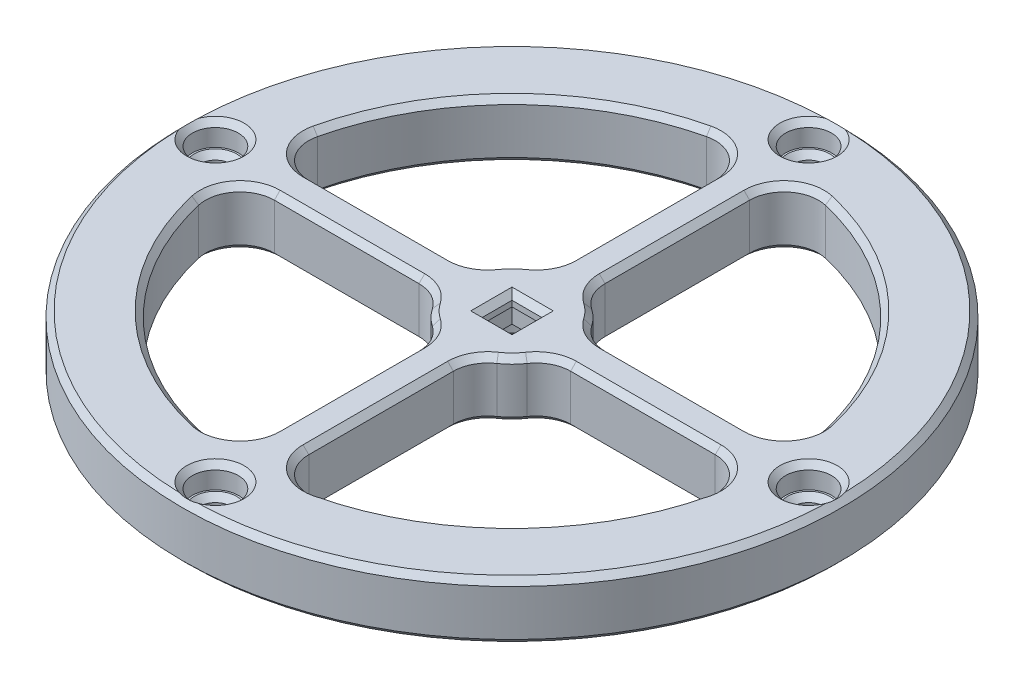
from build123d import *

# Parameters (mm, degrees)
SKETCH1_R           = 36.5125
SKETCH1_R_2         = 1.7145
SKETCH1_W           = 3.302
SKETCH1_H           = 3.302
BOSS_EXTRUDE1_DEPTH = 6.35
FILLET1_R           = 3.81
FILLET2_R           = 3.81
SKETCH2_R           = 2.54
CUT_EXTRUDE4_DEPTH  = 2.54
SKETCH1_4_R         = 5.08
CUT_EXTRUDE2_DEPTH  = 1.27
SKETCH1_5_W         = 6.35
SKETCH1_5_H         = 6.35
CUT_EXTRUDE3_DEPTH  = 5.08
CHAMFER3_SIZE       = 0.635


with BuildPart() as part:
    # Sketch1 → Boss-Extrude1 (new body)
    with BuildSketch(Plane(origin=(0, 0, 0), x_dir=(1, 0, 0), z_dir=(0, 1, 0))):
        with Locations(Location((0, 0, 0), (0, 0, 270))):
            Circle(SKETCH1_R)
        with Locations(Location((-32.86125, 0, 0), (0, 0, 270))):
            Circle(SKETCH1_R_2, mode=Mode.SUBTRACT)
        with BuildLine():
            Line((-1.905, -6.057513929), (-1.905, -28.829629398))
            ThreePointArc((-1.905, -28.829629398), (-20.430082675, -20.430082675), (-28.829629398, -1.905))
            Line((-28.829629398, -1.905), (-6.057513929, -1.905))
            ThreePointArc((-6.057513929, -1.905), (-4.490128061, -4.490128061), (-1.905, -6.057513929))
        make_face(mode=Mode.SUBTRACT)
        with Locations(Location((0, -32.86125, 0), (0, 0, 270))):
            Circle(SKETCH1_R_2, mode=Mode.SUBTRACT)
        with BuildLine():
            Line((1.905, -28.829629398), (1.905, -6.057513929))
            ThreePointArc((1.905, -6.057513929), (4.490128061, -4.490128061), (6.057513929, -1.905))
            Line((6.057513929, -1.905), (28.829629398, -1.905))
            ThreePointArc((28.829629398, -1.905), (20.430082675, -20.430082675), (1.905, -28.829629398))
        make_face(mode=Mode.SUBTRACT)
        with BuildLine():
            Line((-6.057513929, 1.905), (-28.829629398, 1.905))
            ThreePointArc((-28.829629398, 1.905), (-20.430082675, 20.430082675), (-1.905, 28.829629398))
            Line((-1.905, 28.829629398), (-1.905, 6.057513929))
            ThreePointArc((-1.905, 6.057513929), (-4.490128061, 4.490128061), (-6.057513929, 1.905))
        make_face(mode=Mode.SUBTRACT)
        Rectangle(SKETCH1_W, SKETCH1_H, mode=Mode.SUBTRACT)
        with BuildLine():
            Line((28.829629398, 1.905), (6.057513929, 1.905))
            ThreePointArc((6.057513929, 1.905), (4.490128061, 4.490128061), (1.905, 6.057513929))
            Line((1.905, 6.057513929), (1.905, 28.829629398))
            ThreePointArc((1.905, 28.829629398), (20.430082675, 20.430082675), (28.829629398, 1.905))
        make_face(mode=Mode.SUBTRACT)
        with Locations(Location((32.86125, 0, 0), (0, 0, 270))):
            Circle(SKETCH1_R_2, mode=Mode.SUBTRACT)
        with Locations(Location((0, 32.86125, 0), (0, 0, 270))):
            Circle(SKETCH1_R_2, mode=Mode.SUBTRACT)
    extrude(amount=BOSS_EXTRUDE1_DEPTH)

    # Fillet1
    fillet1_edges = [part.edges().sort_by_distance(p)[0] for p in [
        (1.905, 3.175, 6.057513929),
        (6.057513929, 3.175, 1.905),
        (6.057513929, 3.175, -1.905),
        (1.905, 3.175, -6.057513929),
        (-1.905, 3.175, -6.057513929),
        (-6.057513929, 3.175, -1.905),
        (-6.057513929, 3.175, 1.905),
        (-1.905, 3.175, 6.057513929),
    ]]
    fillet(fillet1_edges, radius=FILLET1_R)

    # Fillet2
    fillet2_edges = [part.edges().sort_by_distance(p)[0] for p in [
        (1.905, 3.175, 28.829629398),
        (28.829629398, 3.175, 1.905),
        (28.829629398, 3.175, -1.905),
        (1.905, 3.175, -28.829629398),
        (-1.905, 3.175, -28.829629398),
        (-28.829629398, 3.175, -1.905),
        (-28.829629398, 3.175, 1.905),
        (-1.905, 3.175, 28.829629398),
    ]]
    fillet(fillet2_edges, radius=FILLET2_R)

    # Sketch2 → Cut-Extrude4 (cut)
    with BuildSketch(Plane(origin=(0, 6.35, 0), x_dir=(1, 0, 0), z_dir=(0, 1, 0))):
        with Locations(Location((0, 32.86125, 0), (0, 0, 270))):
            Circle(SKETCH2_R)
        with Locations(Location((32.86125, 0, 0), (0, 0, 270))):
            Circle(SKETCH2_R)
        with Locations(Location((0, -32.86125, 0), (0, 0, 270))):
            Circle(SKETCH2_R)
        with Locations(Location((-32.86125, 0, 0), (0, 0, 270))):
            Circle(SKETCH2_R)
    extrude(amount=-CUT_EXTRUDE4_DEPTH, mode=Mode.SUBTRACT)

    # Sketch1<4> → Cut-Extrude2 (cut)
    with BuildSketch(Plane(origin=(0, 0, 0), x_dir=(1, 0, 0), z_dir=(0, 1, 0))):
        with Locations(Location((0, 0, 0), (0, 0, 270))):
            Circle(SKETCH1_4_R)
    extrude(amount=CUT_EXTRUDE2_DEPTH, mode=Mode.SUBTRACT)

    # Sketch1<5> → Cut-Extrude3 (cut)
    with BuildSketch(Plane(origin=(0, 0, 0), x_dir=(1, 0, 0), z_dir=(0, 1, 0))):
        Rectangle(SKETCH1_5_W, SKETCH1_5_H)
    extrude(amount=CUT_EXTRUDE3_DEPTH, mode=Mode.SUBTRACT)

    # Chamfer3
    # the kernel refuses this chamfer: 0.635 mm, written as the material it takes off along each edge
    with BuildSketch(Plane(origin=(-8.400260413, 0, -1.905), x_dir=(-5.5168229809298586e-15, -0.02749587661058638, 0.9996219169112968), z_dir=(-1, 0, 0)), Plane(origin=(1.905, 0, -8.400260413), x_dir=(-0.9996219169112968, -0.02749587661058638, 2.50498852667661e-15), z_dir=(0, 0, -1)), Plane(origin=(24.422747209, 0, -1.905), x_dir=(0, -0.02749587661058638, 0.9996219169112968), z_dir=(-1, 0, 0)), Plane(origin=(8.400260413, 0, 1.905), x_dir=(0, -0.02749587661058638, -0.9996219169112968), z_dir=(1, 0, 0)), Plane(origin=(1.905, 0, 24.422747209), x_dir=(-0.9996219169112968, -0.02749587661058638, -2.5634707490892933e-15), z_dir=(0, 0, -1)), Plane(origin=(-1.905, 0, 8.400260413), x_dir=(0.9996219169112968, -0.02749587661058638, -3.0605696395971015e-15), z_dir=(0, 0, 1)), Plane(origin=(-24.422747209, 6.35, 1.905), x_dir=(0, -0.9996219169112966, 0.027495876610586282), z_dir=(1, 0, 0)), Plane(origin=(-1.905, 0, -24.422747209), x_dir=(0.9996219169112968, -0.02749587661058638, 2.836387787015148e-15), z_dir=(0, 0, 1))) as chamfer3_piece_1:
        Polygon((CHAMFER3_SIZE * 0.999621916911, CHAMFER3_SIZE * 0.0274958766106), (-CHAMFER3_SIZE * 0.0274958766106, CHAMFER3_SIZE * 0.999621916911), (0, 0), align=None)
    extrude(amount=16.022486797, mode=Mode.SUBTRACT)
    with BuildSketch(Plane(origin=(-8.400260413, 6.35, -1.905), x_dir=(-5.5168229809298586e-15, 0.027495876610585928, 0.9996219169112968), z_dir=(-1, 0, 0)), Plane(origin=(1.905, 6.35, -8.400260413), x_dir=(-0.9996219169112968, 0.027495876610585928, 2.50498852667661e-15), z_dir=(0, 0, -1)), Plane(origin=(24.422747209, 6.35, -1.905), x_dir=(0, 0.027495876610585928, 0.9996219169112968), z_dir=(-1, 0, 0)), Plane(origin=(8.400260413, 6.35, 1.905), x_dir=(0, 0.027495876610585928, -0.9996219169112968), z_dir=(1, 0, 0)), Plane(origin=(1.905, 6.35, 24.422747209), x_dir=(-0.9996219169112968, 0.027495876610585928, -2.5634707490892933e-15), z_dir=(0, 0, -1)), Plane(origin=(-1.905, 6.35, 8.400260413), x_dir=(0.9996219169112968, 0.027495876610585928, -3.0605696395971015e-15), z_dir=(0, 0, 1)), Plane(origin=(-24.422747209, 0, 1.905), x_dir=(0, 0.9996219169112966, 0.02749587661058626), z_dir=(1, 0, 0)), Plane(origin=(-1.905, 6.35, -24.422747209), x_dir=(0.9996219169112968, 0.027495876610585928, 2.836387787015148e-15), z_dir=(0, 0, 1))) as chamfer3_piece_2:
        Polygon((CHAMFER3_SIZE * 0.999621916911, -CHAMFER3_SIZE * 0.0274958766106), (-CHAMFER3_SIZE * 0.0274958766106, -CHAMFER3_SIZE * 0.999621916911), (0, 0), align=None)
    extrude(amount=16.022486797, mode=Mode.SUBTRACT)
    with BuildSketch(Plane(origin=(0, 0, 0), x_dir=(0.8267972847076867, 0, -0.5624999999999969), z_dir=(0.5624999999999969, 0, 0.8267972847076867))) as chamfer3_piece_3:
        Polygon((6.35 - CHAMFER3_SIZE, 0), (6.35, CHAMFER3_SIZE), (6.35, 0), align=None)
    revolve(axis=Axis((0, 0, 0), (0, 1, 0)), revolution_arc=21.542267344, mode=Mode.SUBTRACT)
    with BuildSketch(Plane(origin=(0, 6.35, 0), x_dir=(0.8267972847076867, 0, -0.5624999999999969), z_dir=(0.5624999999999969, 0, 0.8267972847076867))) as chamfer3_piece_4:
        Polygon((6.35 - CHAMFER3_SIZE, 0), (6.35, -CHAMFER3_SIZE), (6.35, 0), align=None)
    revolve(axis=Axis((0, 6.35, 0), (0, 1, 0)), revolution_arc=21.542267344, mode=Mode.SUBTRACT)
    with BuildSketch(Plane(origin=(0, 0, 0), x_dir=(0.5625000000000041, 0, 0.8267972847076818), z_dir=(-0.8267972847076818, 0, 0.5625000000000041))) as chamfer3_piece_5:
        Polygon((6.35 - CHAMFER3_SIZE, 0), (6.35, CHAMFER3_SIZE), (6.35, 0), align=None)
    revolve(axis=Axis((0, 0, 0), (0, 1, 0)), revolution_arc=21.542267344, mode=Mode.SUBTRACT)
    with BuildSketch(Plane(origin=(0, 6.35, 0), x_dir=(0.5625000000000041, 0, 0.8267972847076818), z_dir=(-0.8267972847076818, 0, 0.5625000000000041))) as chamfer3_piece_6:
        Polygon((6.35 - CHAMFER3_SIZE, 0), (6.35, -CHAMFER3_SIZE), (6.35, 0), align=None)
    revolve(axis=Axis((0, 6.35, 0), (0, 1, 0)), revolution_arc=21.542267344, mode=Mode.SUBTRACT)
    with BuildSketch(Plane(origin=(0, 0, 0), x_dir=(-0.8267972847076919, 0, 0.5624999999999892), z_dir=(-0.5624999999999892, 0, -0.8267972847076919))) as chamfer3_piece_7:
        Polygon((6.35 - CHAMFER3_SIZE, 0), (6.35, CHAMFER3_SIZE), (6.35, 0), align=None)
    revolve(axis=Axis((0, 0, 0), (0, 1, 0)), revolution_arc=21.542267344, mode=Mode.SUBTRACT)
    with BuildSketch(Plane(origin=(0, 6.35, 0), x_dir=(-0.8267972847076919, 0, 0.5624999999999892), z_dir=(-0.5624999999999892, 0, -0.8267972847076919))) as chamfer3_piece_8:
        Polygon((6.35 - CHAMFER3_SIZE, 0), (6.35, -CHAMFER3_SIZE), (6.35, 0), align=None)
    revolve(axis=Axis((0, 6.35, 0), (0, 1, 0)), revolution_arc=21.542267344, mode=Mode.SUBTRACT)
    with BuildSketch(Plane(origin=(-5.715, 0, -8.400260413), x_dir=(1, 0, 0), z_dir=(0, 0, -1))) as chamfer3_piece_9:
        Polygon((3.81 + CHAMFER3_SIZE, 0), (3.81, -CHAMFER3_SIZE), (3.81, 0), align=None)
    revolve(axis=Axis((-5.715, 0, -8.400260413), (0, -1, 0)), revolution_arc=55.771133672, mode=Mode.SUBTRACT)
    with BuildSketch(Plane(origin=(-5.715, 6.35, -8.400260413), x_dir=(1, 0, 0), z_dir=(0, 0, -1))) as chamfer3_piece_10:
        Polygon((3.81 + CHAMFER3_SIZE, 0), (3.81, CHAMFER3_SIZE), (3.81, 0), align=None)
    revolve(axis=Axis((-5.715, 6.35, -8.400260413), (0, -1, 0)), revolution_arc=55.771133672, mode=Mode.SUBTRACT)
    with BuildSketch(Plane(origin=(-8.400260413, 0, -5.715), x_dir=(0.826797284707692, 0, 0.562499999999989), z_dir=(0.562499999999989, 0, -0.826797284707692))) as chamfer3_piece_11:
        Polygon((3.81 + CHAMFER3_SIZE, 0), (3.81, -CHAMFER3_SIZE), (3.81, 0), align=None)
    revolve(axis=Axis((-8.400260413, 0, -5.715), (0, -1, 0)), revolution_arc=55.771133672, mode=Mode.SUBTRACT)
    with BuildSketch(Plane(origin=(-8.400260413, 6.35, -5.715), x_dir=(0.826797284707692, 0, 0.562499999999989), z_dir=(0.562499999999989, 0, -0.826797284707692))) as chamfer3_piece_12:
        Polygon((3.81 + CHAMFER3_SIZE, 0), (3.81, CHAMFER3_SIZE), (3.81, 0), align=None)
    revolve(axis=Axis((-8.400260413, 6.35, -5.715), (0, -1, 0)), revolution_arc=55.771133672, mode=Mode.SUBTRACT)
    with BuildSketch(Plane(origin=(5.715, 0, -8.400260413), x_dir=(-0.562500000000004, 0, 0.8267972847076819), z_dir=(0.8267972847076819, 0, 0.562500000000004))) as chamfer3_piece_13:
        Polygon((3.81 + CHAMFER3_SIZE, 0), (3.81, -CHAMFER3_SIZE), (3.81, 0), align=None)
    revolve(axis=Axis((5.715, 0, -8.400260413), (0, -1, 0)), revolution_arc=55.771133672, mode=Mode.SUBTRACT)
    with BuildSketch(Plane(origin=(5.715, 6.35, -8.400260413), x_dir=(-0.562500000000004, 0, 0.8267972847076819), z_dir=(0.8267972847076819, 0, 0.562500000000004))) as chamfer3_piece_14:
        Polygon((3.81 + CHAMFER3_SIZE, 0), (3.81, CHAMFER3_SIZE), (3.81, 0), align=None)
    revolve(axis=Axis((5.715, 6.35, -8.400260413), (0, -1, 0)), revolution_arc=55.771133672, mode=Mode.SUBTRACT)
    with BuildSketch(Plane(origin=(8.400260413, 0, -5.715), x_dir=(0, 0, 1), z_dir=(1, 0, 0))) as chamfer3_piece_15:
        Polygon((3.81 + CHAMFER3_SIZE, 0), (3.81, -CHAMFER3_SIZE), (3.81, 0), align=None)
    revolve(axis=Axis((8.400260413, 0, -5.715), (0, -1, 0)), revolution_arc=55.771133672, mode=Mode.SUBTRACT)
    with BuildSketch(Plane(origin=(8.400260413, 6.35, -5.715), x_dir=(0, 0, 1), z_dir=(1, 0, 0))) as chamfer3_piece_16:
        Polygon((3.81 + CHAMFER3_SIZE, 0), (3.81, CHAMFER3_SIZE), (3.81, 0), align=None)
    revolve(axis=Axis((8.400260413, 6.35, -5.715), (0, -1, 0)), revolution_arc=55.771133672, mode=Mode.SUBTRACT)
    with BuildSketch(Plane(origin=(8.400260413, 0, 5.715), x_dir=(-0.8267972847076864, 0, -0.5624999999999973), z_dir=(-0.5624999999999973, 0, 0.8267972847076864))) as chamfer3_piece_17:
        Polygon((3.81 + CHAMFER3_SIZE, 0), (3.81, -CHAMFER3_SIZE), (3.81, 0), align=None)
    revolve(axis=Axis((8.400260413, 0, 5.715), (0, -1, 0)), revolution_arc=55.771133672, mode=Mode.SUBTRACT)
    with BuildSketch(Plane(origin=(8.400260413, 6.35, 5.715), x_dir=(-0.8267972847076864, 0, -0.5624999999999973), z_dir=(-0.5624999999999973, 0, 0.8267972847076864))) as chamfer3_piece_18:
        Polygon((3.81 + CHAMFER3_SIZE, 0), (3.81, CHAMFER3_SIZE), (3.81, 0), align=None)
    revolve(axis=Axis((8.400260413, 6.35, 5.715), (0, -1, 0)), revolution_arc=55.771133672, mode=Mode.SUBTRACT)
    with BuildSketch(Plane(origin=(5.715, 0, 8.400260413), x_dir=(-1, 0, 0), z_dir=(0, 0, 1))) as chamfer3_piece_19:
        Polygon((3.81 + CHAMFER3_SIZE, 0), (3.81, -CHAMFER3_SIZE), (3.81, 0), align=None)
    revolve(axis=Axis((5.715, 0, 8.400260413), (0, -1, 0)), revolution_arc=55.771133672, mode=Mode.SUBTRACT)
    with BuildSketch(Plane(origin=(5.715, 6.35, 8.400260413), x_dir=(-1, 0, 0), z_dir=(0, 0, 1))) as chamfer3_piece_20:
        Polygon((3.81 + CHAMFER3_SIZE, 0), (3.81, CHAMFER3_SIZE), (3.81, 0), align=None)
    revolve(axis=Axis((5.715, 6.35, 8.400260413), (0, -1, 0)), revolution_arc=55.771133672, mode=Mode.SUBTRACT)
    with BuildSketch(Plane(origin=(-5.715, 0, 8.400260413), x_dir=(0.5625000000000068, 0, -0.82679728470768), z_dir=(-0.82679728470768, 0, -0.5625000000000068))) as chamfer3_piece_21:
        Polygon((3.81 + CHAMFER3_SIZE, 0), (3.81, -CHAMFER3_SIZE), (3.81, 0), align=None)
    revolve(axis=Axis((-5.715, 0, 8.400260413), (0, -1, 0)), revolution_arc=55.771133672, mode=Mode.SUBTRACT)
    with BuildSketch(Plane(origin=(-5.715, 6.35, 8.400260413), x_dir=(0.5625000000000068, 0, -0.82679728470768), z_dir=(-0.82679728470768, 0, -0.5625000000000068))) as chamfer3_piece_22:
        Polygon((3.81 + CHAMFER3_SIZE, 0), (3.81, CHAMFER3_SIZE), (3.81, 0), align=None)
    revolve(axis=Axis((-5.715, 6.35, 8.400260413), (0, -1, 0)), revolution_arc=55.771133672, mode=Mode.SUBTRACT)
    with BuildSketch(Plane(origin=(-8.400260413, 0, 5.715), x_dir=(0, 0, -1), z_dir=(-1, 0, 0))) as chamfer3_piece_23:
        Polygon((3.81 + CHAMFER3_SIZE, 0), (3.81, -CHAMFER3_SIZE), (3.81, 0), align=None)
    revolve(axis=Axis((-8.400260413, 0, 5.715), (0, -1, 0)), revolution_arc=55.771133672, mode=Mode.SUBTRACT)
    with BuildSketch(Plane(origin=(-8.400260413, 6.35, 5.715), x_dir=(0, 0, -1), z_dir=(-1, 0, 0))) as chamfer3_piece_24:
        Polygon((3.81, CHAMFER3_SIZE), (3.81 + CHAMFER3_SIZE, 0), (3.81, 0), align=None)
    revolve(axis=Axis((-8.400260413, 6.35, 5.715), (0, -1, 0)), revolution_arc=55.771133672, mode=Mode.SUBTRACT)
    with BuildSketch(Plane(origin=(0, 0, 0), x_dir=(0.22784810126582303, 0, -0.9736966892978323), z_dir=(-0.9736966892978323, 0, -0.22784810126582303))) as chamfer3_piece_25:
        Polygon((28.8925 + CHAMFER3_SIZE, 0), (28.8925, -CHAMFER3_SIZE), (28.8925, 0), align=None)
    revolve(axis=Axis((0, 0, 0), (0, -1, 0)), revolution_arc=63.659172995, mode=Mode.SUBTRACT)
    with BuildSketch(Plane(origin=(0, 6.35, 0), x_dir=(0.22784810126582303, 0, -0.9736966892978323), z_dir=(-0.9736966892978323, 0, -0.22784810126582303))) as chamfer3_piece_26:
        Polygon((28.8925 + CHAMFER3_SIZE, 0), (28.8925, CHAMFER3_SIZE), (28.8925, 0), align=None)
    revolve(axis=Axis((0, 6.35, 0), (0, -1, 0)), revolution_arc=63.659172995, mode=Mode.SUBTRACT)
    with BuildSketch(Plane(origin=(0, 0, 0), x_dir=(0.9736966892978326, 0, 0.22784810126582175), z_dir=(0.22784810126582175, 0, -0.9736966892978326))) as chamfer3_piece_27:
        Polygon((28.8925 + CHAMFER3_SIZE, 0), (28.8925, -CHAMFER3_SIZE), (28.8925, 0), align=None)
    revolve(axis=Axis((0, 0, 0), (0, -1, 0)), revolution_arc=63.659172995, mode=Mode.SUBTRACT)
    with BuildSketch(Plane(origin=(0, 6.35, 0), x_dir=(0.9736966892978326, 0, 0.22784810126582175), z_dir=(0.22784810126582175, 0, -0.9736966892978326))) as chamfer3_piece_28:
        Polygon((28.8925 + CHAMFER3_SIZE, 0), (28.8925, CHAMFER3_SIZE), (28.8925, 0), align=None)
    revolve(axis=Axis((0, 6.35, 0), (0, -1, 0)), revolution_arc=63.659172995, mode=Mode.SUBTRACT)
    with BuildSketch(Plane(origin=(0, 0, 0), x_dir=(-0.22784810126582355, 0, 0.9736966892978322), z_dir=(0.9736966892978322, 0, 0.22784810126582355))) as chamfer3_piece_29:
        Polygon((28.8925 + CHAMFER3_SIZE, 0), (28.8925, -CHAMFER3_SIZE), (28.8925, 0), align=None)
    revolve(axis=Axis((0, 0, 0), (0, -1, 0)), revolution_arc=63.659172995, mode=Mode.SUBTRACT)
    with BuildSketch(Plane(origin=(0, 6.35, 0), x_dir=(-0.22784810126582355, 0, 0.9736966892978322), z_dir=(0.9736966892978322, 0, 0.22784810126582355))) as chamfer3_piece_30:
        Polygon((28.8925 + CHAMFER3_SIZE, 0), (28.8925, CHAMFER3_SIZE), (28.8925, 0), align=None)
    revolve(axis=Axis((0, 6.35, 0), (0, -1, 0)), revolution_arc=63.659172995, mode=Mode.SUBTRACT)
    with BuildSketch(Plane(origin=(0, 0, 0), x_dir=(-0.9736966892978325, 0, -0.22784810126582164), z_dir=(-0.22784810126582164, 0, 0.9736966892978325))) as chamfer3_piece_31:
        Polygon((28.8925 + CHAMFER3_SIZE, 0), (28.8925, -CHAMFER3_SIZE), (28.8925, 0), align=None)
    revolve(axis=Axis((0, 0, 0), (0, -1, 0)), revolution_arc=63.659172995, mode=Mode.SUBTRACT)
    with BuildSketch(Plane(origin=(0, 6.35, 0), x_dir=(-0.9736966892978325, 0, -0.22784810126582164), z_dir=(-0.22784810126582164, 0, 0.9736966892978325))) as chamfer3_piece_32:
        Polygon((28.8925 + CHAMFER3_SIZE, 0), (28.8925, CHAMFER3_SIZE), (28.8925, 0), align=None)
    revolve(axis=Axis((0, 6.35, 0), (0, -1, 0)), revolution_arc=63.659172995, mode=Mode.SUBTRACT)
    with BuildSketch(Plane(origin=(24.422747209, 0, -5.715), x_dir=(0, 0, 1), z_dir=(-1, 0, 0))) as chamfer3_piece_33:
        Polygon((3.81 + CHAMFER3_SIZE, 0), (3.81, CHAMFER3_SIZE), (3.81, 0), align=None)
    revolve(axis=Axis((24.422747209, 0, -5.715), (0, 1, 0)), revolution_arc=103.170413502, mode=Mode.SUBTRACT)
    with BuildSketch(Plane(origin=(24.422747209, 6.35, -5.715), x_dir=(0, 0, 1), z_dir=(-1, 0, 0))) as chamfer3_piece_34:
        Polygon((3.81 + CHAMFER3_SIZE, 0), (3.81, -CHAMFER3_SIZE), (3.81, 0), align=None)
    revolve(axis=Axis((24.422747209, 6.35, -5.715), (0, 1, 0)), revolution_arc=103.170413502, mode=Mode.SUBTRACT)
    with BuildSketch(Plane(origin=(24.422747209, 0, 5.715), x_dir=(0.9736966892978325, 0, 0.22784810126582164), z_dir=(-0.22784810126582164, 0, 0.9736966892978325))) as chamfer3_piece_35:
        Polygon((3.81 + CHAMFER3_SIZE, 0), (3.81, CHAMFER3_SIZE), (3.81, 0), align=None)
    revolve(axis=Axis((24.422747209, 0, 5.715), (0, 1, 0)), revolution_arc=103.170413502, mode=Mode.SUBTRACT)
    with BuildSketch(Plane(origin=(24.422747209, 6.35, 5.715), x_dir=(0.9736966892978325, 0, 0.22784810126582164), z_dir=(-0.22784810126582164, 0, 0.9736966892978325))) as chamfer3_piece_36:
        Polygon((3.81 + CHAMFER3_SIZE, 0), (3.81, -CHAMFER3_SIZE), (3.81, 0), align=None)
    revolve(axis=Axis((24.422747209, 6.35, 5.715), (0, 1, 0)), revolution_arc=103.170413502, mode=Mode.SUBTRACT)
    with BuildSketch(Plane(origin=(5.715, 0, 24.422747209), x_dir=(-1, 0, 0), z_dir=(0, 0, -1))) as chamfer3_piece_37:
        Polygon((3.81 + CHAMFER3_SIZE, 0), (3.81, CHAMFER3_SIZE), (3.81, 0), align=None)
    revolve(axis=Axis((5.715, 0, 24.422747209), (0, 1, 0)), revolution_arc=103.170413502, mode=Mode.SUBTRACT)
    with BuildSketch(Plane(origin=(5.715, 6.35, 24.422747209), x_dir=(-1, 0, 0), z_dir=(0, 0, -1))) as chamfer3_piece_38:
        Polygon((3.81 + CHAMFER3_SIZE, 0), (3.81, -CHAMFER3_SIZE), (3.81, 0), align=None)
    revolve(axis=Axis((5.715, 6.35, 24.422747209), (0, 1, 0)), revolution_arc=103.170413502, mode=Mode.SUBTRACT)
    with BuildSketch(Plane(origin=(-5.715, 0, 24.422747209), x_dir=(-0.22784810126582408, 0, 0.973696689297832), z_dir=(-0.973696689297832, 0, -0.22784810126582408))) as chamfer3_piece_39:
        Polygon((3.81 + CHAMFER3_SIZE, 0), (3.81, CHAMFER3_SIZE), (3.81, 0), align=None)
    revolve(axis=Axis((-5.715, 0, 24.422747209), (0, 1, 0)), revolution_arc=103.170413502, mode=Mode.SUBTRACT)
    with BuildSketch(Plane(origin=(-5.715, 6.35, 24.422747209), x_dir=(-0.22784810126582408, 0, 0.973696689297832), z_dir=(-0.973696689297832, 0, -0.22784810126582408))) as chamfer3_piece_40:
        Polygon((3.81 + CHAMFER3_SIZE, 0), (3.81, -CHAMFER3_SIZE), (3.81, 0), align=None)
    revolve(axis=Axis((-5.715, 6.35, 24.422747209), (0, 1, 0)), revolution_arc=103.170413502, mode=Mode.SUBTRACT)
    with BuildSketch(Plane(origin=(-24.422747209, 0, -5.715), x_dir=(-0.9736966892978324, 0, -0.2278481012658223), z_dir=(0.2278481012658223, 0, -0.9736966892978324))) as chamfer3_piece_41:
        Polygon((3.81 + CHAMFER3_SIZE, 0), (3.81, CHAMFER3_SIZE), (3.81, 0), align=None)
    revolve(axis=Axis((-24.422747209, 0, -5.715), (0, 1, 0)), revolution_arc=103.170413502, mode=Mode.SUBTRACT)
    with BuildSketch(Plane(origin=(-24.422747209, 6.35, -5.715), x_dir=(-0.9736966892978324, 0, -0.2278481012658223), z_dir=(0.2278481012658223, 0, -0.9736966892978324))) as chamfer3_piece_42:
        Polygon((3.81 + CHAMFER3_SIZE, 0), (3.81, -CHAMFER3_SIZE), (3.81, 0), align=None)
    revolve(axis=Axis((-24.422747209, 6.35, -5.715), (0, 1, 0)), revolution_arc=103.170413502, mode=Mode.SUBTRACT)
    with BuildSketch(Plane(origin=(-24.422747209, 0, 5.715), x_dir=(0, 0, -1), z_dir=(1, 0, 0))) as chamfer3_piece_43:
        Polygon((3.81 + CHAMFER3_SIZE, 0), (3.81, CHAMFER3_SIZE), (3.81, 0), align=None)
    revolve(axis=Axis((-24.422747209, 0, 5.715), (0, 1, 0)), revolution_arc=103.170413502, mode=Mode.SUBTRACT)
    with BuildSketch(Plane(origin=(-24.422747209, 6.35, 5.715), x_dir=(0, 0, -1), z_dir=(1, 0, 0))) as chamfer3_piece_44:
        Polygon((3.81, -CHAMFER3_SIZE), (3.81 + CHAMFER3_SIZE, 0), (3.81, 0), align=None)
    revolve(axis=Axis((-24.422747209, 6.35, 5.715), (0, 1, 0)), revolution_arc=103.170413502, mode=Mode.SUBTRACT)
    with BuildSketch(Plane(origin=(5.715, 0, -24.422747209), x_dir=(0.2278481012658232, 0, -0.9736966892978322), z_dir=(0.9736966892978322, 0, 0.2278481012658232))) as chamfer3_piece_45:
        Polygon((3.81 + CHAMFER3_SIZE, 0), (3.81, CHAMFER3_SIZE), (3.81, 0), align=None)
    revolve(axis=Axis((5.715, 0, -24.422747209), (0, 1, 0)), revolution_arc=103.170413502, mode=Mode.SUBTRACT)
    with BuildSketch(Plane(origin=(5.715, 6.35, -24.422747209), x_dir=(0.2278481012658232, 0, -0.9736966892978322), z_dir=(0.9736966892978322, 0, 0.2278481012658232))) as chamfer3_piece_46:
        Polygon((3.81 + CHAMFER3_SIZE, 0), (3.81, -CHAMFER3_SIZE), (3.81, 0), align=None)
    revolve(axis=Axis((5.715, 6.35, -24.422747209), (0, 1, 0)), revolution_arc=103.170413502, mode=Mode.SUBTRACT)
    with BuildSketch(Plane(origin=(-5.715, 0, -24.422747209), x_dir=(1, 0, 0), z_dir=(0, 0, 1))) as chamfer3_piece_47:
        Polygon((3.81 + CHAMFER3_SIZE, 0), (3.81, CHAMFER3_SIZE), (3.81, 0), align=None)
    revolve(axis=Axis((-5.715, 0, -24.422747209), (0, 1, 0)), revolution_arc=103.170413502, mode=Mode.SUBTRACT)
    with BuildSketch(Plane(origin=(-5.715, 6.35, -24.422747209), x_dir=(1, 0, 0), z_dir=(0, 0, 1))) as chamfer3_piece_48:
        Polygon((3.81 + CHAMFER3_SIZE, 0), (3.81, -CHAMFER3_SIZE), (3.81, 0), align=None)
    revolve(axis=Axis((-5.715, 6.35, -24.422747209), (0, 1, 0)), revolution_arc=103.170413502, mode=Mode.SUBTRACT)
    with BuildSketch(Plane(origin=(-32.86125, 0, 0), x_dir=(0, 0, 1), z_dir=(-1, 0, 0))) as chamfer3_piece_49:
        Polygon((1.7145 + CHAMFER3_SIZE, 0), (1.7145, CHAMFER3_SIZE), (1.7145, 0), align=None)
    revolve(axis=Axis((-32.86125, 0, 0), (0, 1, 0)), mode=Mode.SUBTRACT)
    with BuildSketch(Plane(origin=(0, 0, -32.86125), x_dir=(0, 0, 1), z_dir=(-1, 0, 0))) as chamfer3_piece_50:
        Polygon((1.7145 + CHAMFER3_SIZE, 0), (1.7145, CHAMFER3_SIZE), (1.7145, 0), align=None)
    revolve(axis=Axis((0, 0, -32.86125), (0, 1, 0)), mode=Mode.SUBTRACT)
    with BuildSketch(Plane(origin=(32.86125, 0, 0), x_dir=(0, 0, 1), z_dir=(-1, 0, 0))) as chamfer3_piece_51:
        Polygon((1.7145 + CHAMFER3_SIZE, 0), (1.7145, CHAMFER3_SIZE), (1.7145, 0), align=None)
    revolve(axis=Axis((32.86125, 0, 0), (0, 1, 0)), mode=Mode.SUBTRACT)
    with BuildSketch(Plane(origin=(0, 0, 32.86125), x_dir=(0, 0, 1), z_dir=(-1, 0, 0))) as chamfer3_piece_52:
        Polygon((1.7145 + CHAMFER3_SIZE, 0), (1.7145, CHAMFER3_SIZE), (1.7145, 0), align=None)
    revolve(axis=Axis((0, 0, 32.86125), (0, 1, 0)), mode=Mode.SUBTRACT)
    with BuildSketch(Plane(origin=(0, 0, 0), x_dir=(0, 0, 1), z_dir=(-1, 0, 0))) as chamfer3_piece_53:
        Polygon((36.5125 - CHAMFER3_SIZE, 0), (36.5125, CHAMFER3_SIZE), (36.5125, 0), align=None)
    revolve(axis=Axis((0, 0, 0), (0, 1, 0)), mode=Mode.SUBTRACT)
    with BuildSketch(Plane(origin=(-32.86125, 3.81, 0), x_dir=(0, 0, 1), z_dir=(1, 0, 0))) as chamfer3_piece_54:
        Polygon((1.7145, CHAMFER3_SIZE), (1.7145 + CHAMFER3_SIZE, 0), (1.7145, 0), align=None)
    revolve(axis=Axis((-32.86125, 3.81, 0), (0, -1, 0)), mode=Mode.SUBTRACT)
    with BuildSketch(Plane(origin=(-32.86125, 6.35, 0), x_dir=(0, 0, 1), z_dir=(-1, 0, 0))) as chamfer3_piece_55:
        Polygon((2.54 + CHAMFER3_SIZE, 0), (2.54, -CHAMFER3_SIZE), (2.54, 0), align=None)
    revolve(axis=Axis((-32.86125, 6.35, 0), (0, 1, 0)), mode=Mode.SUBTRACT)
    with BuildSketch(Plane(origin=(0, 3.81, 32.86125), x_dir=(0, 0, 1), z_dir=(1, 0, 0))) as chamfer3_piece_56:
        Polygon((1.7145, CHAMFER3_SIZE), (1.7145 + CHAMFER3_SIZE, 0), (1.7145, 0), align=None)
    revolve(axis=Axis((0, 3.81, 32.86125), (0, -1, 0)), mode=Mode.SUBTRACT)
    with BuildSketch(Plane(origin=(0, 6.35, 32.86125), x_dir=(0, 0, 1), z_dir=(-1, 0, 0))) as chamfer3_piece_57:
        Polygon((2.54 + CHAMFER3_SIZE, 0), (2.54, -CHAMFER3_SIZE), (2.54, 0), align=None)
    revolve(axis=Axis((0, 6.35, 32.86125), (0, 1, 0)), mode=Mode.SUBTRACT)
    with BuildSketch(Plane(origin=(32.86125, 3.81, 0), x_dir=(0, 0, 1), z_dir=(1, 0, 0))) as chamfer3_piece_58:
        Polygon((1.7145, CHAMFER3_SIZE), (1.7145 + CHAMFER3_SIZE, 0), (1.7145, 0), align=None)
    revolve(axis=Axis((32.86125, 3.81, 0), (0, -1, 0)), mode=Mode.SUBTRACT)
    with BuildSketch(Plane(origin=(32.86125, 6.35, 0), x_dir=(0, 0, 1), z_dir=(-1, 0, 0))) as chamfer3_piece_59:
        Polygon((2.54 + CHAMFER3_SIZE, 0), (2.54, -CHAMFER3_SIZE), (2.54, 0), align=None)
    revolve(axis=Axis((32.86125, 6.35, 0), (0, 1, 0)), mode=Mode.SUBTRACT)
    with BuildSketch(Plane(origin=(0, 3.81, -32.86125), x_dir=(0, 0, 1), z_dir=(1, 0, 0))) as chamfer3_piece_60:
        Polygon((1.7145, CHAMFER3_SIZE), (1.7145 + CHAMFER3_SIZE, 0), (1.7145, 0), align=None)
    revolve(axis=Axis((0, 3.81, -32.86125), (0, -1, 0)), mode=Mode.SUBTRACT)
    with BuildSketch(Plane(origin=(0, 6.35, -32.86125), x_dir=(0, 0, 1), z_dir=(-1, 0, 0))) as chamfer3_piece_61:
        Polygon((2.54 + CHAMFER3_SIZE, 0), (2.54, -CHAMFER3_SIZE), (2.54, 0), align=None)
    revolve(axis=Axis((0, 6.35, -32.86125), (0, 1, 0)), mode=Mode.SUBTRACT)
    with BuildSketch(Plane(origin=(0, 0, 0), x_dir=(0, 0, 1), z_dir=(-1, 0, 0))) as chamfer3_piece_62:
        Polygon((5.08 + CHAMFER3_SIZE, 0), (5.08, CHAMFER3_SIZE), (5.08, 0), align=None)
    revolve(axis=Axis((0, 0, 0), (0, 1, 0)), mode=Mode.SUBTRACT)
    with BuildSketch(Plane(origin=(-3.175, 1.27, 3.175), x_dir=(-0.9996219169112968, -0.027495876610586268, 0), z_dir=(0, 0, -1)), Plane(origin=(-3.175, 1.27, -3.175), x_dir=(0, -0.027495876610586268, -0.9996219169112968), z_dir=(1, 0, 0)), Plane(origin=(3.175, 1.27, -3.175), x_dir=(0.9996219169112968, -0.027495876610586268, 0), z_dir=(0, 0, 1)), Plane(origin=(3.175, 1.27, 3.175), x_dir=(0, -0.027495876610586268, 0.9996219169112968), z_dir=(-1, 0, 0))) as chamfer3_piece_63:
        Polygon((CHAMFER3_SIZE * 0.999621916911, CHAMFER3_SIZE * 0.0274958766106), (-CHAMFER3_SIZE * 0.0274958766106, CHAMFER3_SIZE * 0.999621916911), (0, 0), align=None)
    extrude(amount=6.35, mode=Mode.SUBTRACT)
    with BuildSketch(Plane(origin=(-1.651, 6.35, 1.651), x_dir=(-0.9996219169112968, 0.027495876610585928, 0), z_dir=(0, 0, -1)), Plane(origin=(-1.651, 6.35, -1.651), x_dir=(0, 0.02749587661058592, -0.9996219169112968), z_dir=(1, 0, 0)), Plane(origin=(1.651, 6.35, -1.651), x_dir=(0.9996219169112968, 0.02749587661058592, 0), z_dir=(0, 0, 1)), Plane(origin=(1.651, 6.35, 1.651), x_dir=(0, 0.027495876610585928, 0.9996219169112968), z_dir=(-1, 0, 0))) as chamfer3_piece_64:
        Polygon((CHAMFER3_SIZE * 0.999621916911, -CHAMFER3_SIZE * 0.0274958766106), (-CHAMFER3_SIZE * 0.0274958766106, -CHAMFER3_SIZE * 0.999621916911), (0, 0), align=None)
    extrude(amount=3.302, mode=Mode.SUBTRACT)
    with BuildSketch(Plane(origin=(0, 6.35, 0), x_dir=(0, 0, 1), z_dir=(-1, 0, 0))) as chamfer3_piece_65:
        Polygon((36.5125 - CHAMFER3_SIZE, 0), (36.5125, -CHAMFER3_SIZE), (36.5125, 0), align=None)
    revolve(axis=Axis((0, 6.35, 0), (0, 1, 0)), mode=Mode.SUBTRACT)
    with BuildSketch(Plane(origin=(0, 0, 0), x_dir=(-0.5625000000000064, 0, -0.8267972847076802), z_dir=(0.8267972847076802, 0, -0.5625000000000064))) as chamfer3_piece_66:
        Polygon((6.35 - CHAMFER3_SIZE, 0), (6.35, CHAMFER3_SIZE), (6.35, 0), align=None)
    revolve(axis=Axis((0, 0, 0), (0, 1, 0)), revolution_arc=21.542267344, mode=Mode.SUBTRACT)
    with BuildSketch(Plane(origin=(0, 6.35, 0), x_dir=(-0.5625000000000064, 0, -0.8267972847076802), z_dir=(0.8267972847076802, 0, -0.5625000000000064))) as chamfer3_piece_67:
        Polygon((6.35 - CHAMFER3_SIZE, 0), (6.35, -CHAMFER3_SIZE), (6.35, 0), align=None)
    revolve(axis=Axis((0, 6.35, 0), (0, 1, 0)), revolution_arc=21.542267344, mode=Mode.SUBTRACT)
    with BuildSketch(Plane(origin=(-3.175, 1.27, 4.808018697), x_dir=(-0.9996219169112968, -0.027495876610586268, 0), z_dir=(0, 0, -1))) as chamfer3_piece_68a_section:
        Polygon((CHAMFER3_SIZE * 0.999621916911, CHAMFER3_SIZE * 0.0274958766106), (-CHAMFER3_SIZE * 0.0274958766106, CHAMFER3_SIZE * 0.999621916911), (0, 0), align=None)
    chamfer3_piece_68a = extrude(amount=7.983018697, mode=Mode.PRIVATE)
    chamfer3_piece_68a = chamfer3_piece_68a & Plane(origin=(0, 1.500095765, 0), x_dir=(0, 0, 1), z_dir=(0, -1, 0)) * Cylinder(5.08, 19, mode=Mode.PRIVATE)
    chamfer3_piece_68a = split(chamfer3_piece_68a, bisect_by=Plane(origin=(-3.345660547, 1.500095765, 3.175), z_dir=(0, 0, 1)), keep=Keep.TOP, mode=Mode.PRIVATE)
    with BuildSketch(Plane(origin=(3.175, 1.27, 3.175), x_dir=(0, -0.027495876610586268, 0.9996219169112968), z_dir=(-1, 0, 0))) as chamfer3_piece_68b_section:
        Polygon((CHAMFER3_SIZE * 0.999621916911, CHAMFER3_SIZE * 0.0274958766106), (-CHAMFER3_SIZE * 0.0274958766106, CHAMFER3_SIZE * 0.999621916911), (0, 0), align=None)
    chamfer3_piece_68b = extrude(amount=7.983018697, mode=Mode.PRIVATE)
    chamfer3_piece_68b = chamfer3_piece_68b & Plane(origin=(0, 1.500095765, 0), x_dir=(0, 0, 1), z_dir=(0, -1, 0)) * Cylinder(5.08, 19, mode=Mode.PRIVATE)
    chamfer3_piece_68b = split(chamfer3_piece_68b, bisect_by=Plane(origin=(-3.175, 1.500095765, 3.345660547), z_dir=(-1, 0, 0)), keep=Keep.TOP, mode=Mode.PRIVATE)
    chamfer3_piece_68 = chamfer3_piece_68a & chamfer3_piece_68b
    add(chamfer3_piece_68, mode=Mode.SUBTRACT)
    with BuildSketch(Plane(origin=(-4.808018697, 1.27, -3.175), x_dir=(0, -0.027495876610586268, -0.9996219169112968), z_dir=(1, 0, 0))) as chamfer3_piece_69a_section:
        Polygon((CHAMFER3_SIZE * 0.999621916911, CHAMFER3_SIZE * 0.0274958766106), (-CHAMFER3_SIZE * 0.0274958766106, CHAMFER3_SIZE * 0.999621916911), (0, 0), align=None)
    chamfer3_piece_69a = extrude(amount=7.983018697, mode=Mode.PRIVATE)
    chamfer3_piece_69a = chamfer3_piece_69a & Plane(origin=(0, 1.500095765, 0), x_dir=(0, 0, 1), z_dir=(0, -1, 0)) * Cylinder(5.08, 19, mode=Mode.PRIVATE)
    chamfer3_piece_69a = split(chamfer3_piece_69a, bisect_by=Plane(origin=(-3.175, 1.500095765, -3.345660547), z_dir=(-1, 0, 0)), keep=Keep.TOP, mode=Mode.PRIVATE)
    with BuildSketch(Plane(origin=(-3.175, 1.27, 3.175), x_dir=(-0.9996219169112968, -0.027495876610586268, 0), z_dir=(0, 0, -1))) as chamfer3_piece_69b_section:
        Polygon((CHAMFER3_SIZE * 0.999621916911, CHAMFER3_SIZE * 0.0274958766106), (-CHAMFER3_SIZE * 0.0274958766106, CHAMFER3_SIZE * 0.999621916911), (0, 0), align=None)
    chamfer3_piece_69b = extrude(amount=7.983018697, mode=Mode.PRIVATE)
    chamfer3_piece_69b = chamfer3_piece_69b & Plane(origin=(0, 1.500095765, 0), x_dir=(0, 0, 1), z_dir=(0, -1, 0)) * Cylinder(5.08, 19, mode=Mode.PRIVATE)
    chamfer3_piece_69b = split(chamfer3_piece_69b, bisect_by=Plane(origin=(-3.345660547, 1.500095765, -3.175), z_dir=(0, 0, -1)), keep=Keep.TOP, mode=Mode.PRIVATE)
    chamfer3_piece_69 = chamfer3_piece_69a & chamfer3_piece_69b
    add(chamfer3_piece_69, mode=Mode.SUBTRACT)
    with BuildSketch(Plane(origin=(3.175, 1.27, -4.808018697), x_dir=(0.9996219169112968, -0.027495876610586268, 0), z_dir=(0, 0, 1))) as chamfer3_piece_70a_section:
        Polygon((CHAMFER3_SIZE * 0.999621916911, CHAMFER3_SIZE * 0.0274958766106), (-CHAMFER3_SIZE * 0.0274958766106, CHAMFER3_SIZE * 0.999621916911), (0, 0), align=None)
    chamfer3_piece_70a = extrude(amount=7.983018697, mode=Mode.PRIVATE)
    chamfer3_piece_70a = chamfer3_piece_70a & Plane(origin=(0, 1.500095765, 0), x_dir=(0, 0, 1), z_dir=(0, -1, 0)) * Cylinder(5.08, 19, mode=Mode.PRIVATE)
    chamfer3_piece_70a = split(chamfer3_piece_70a, bisect_by=Plane(origin=(3.345660547, 1.500095765, -3.175), z_dir=(0, 0, -1)), keep=Keep.TOP, mode=Mode.PRIVATE)
    with BuildSketch(Plane(origin=(-3.175, 1.27, -3.175), x_dir=(0, -0.027495876610586268, -0.9996219169112968), z_dir=(1, 0, 0))) as chamfer3_piece_70b_section:
        Polygon((CHAMFER3_SIZE * 0.999621916911, CHAMFER3_SIZE * 0.0274958766106), (-CHAMFER3_SIZE * 0.0274958766106, CHAMFER3_SIZE * 0.999621916911), (0, 0), align=None)
    chamfer3_piece_70b = extrude(amount=7.983018697, mode=Mode.PRIVATE)
    chamfer3_piece_70b = chamfer3_piece_70b & Plane(origin=(0, 1.500095765, 0), x_dir=(0, 0, 1), z_dir=(0, -1, 0)) * Cylinder(5.08, 19, mode=Mode.PRIVATE)
    chamfer3_piece_70b = split(chamfer3_piece_70b, bisect_by=Plane(origin=(3.175, 1.500095765, -3.345660547), z_dir=(1, 0, 0)), keep=Keep.TOP, mode=Mode.PRIVATE)
    chamfer3_piece_70 = chamfer3_piece_70a & chamfer3_piece_70b
    add(chamfer3_piece_70, mode=Mode.SUBTRACT)
    with BuildSketch(Plane(origin=(3.175, 1.27, -3.175), x_dir=(0.9996219169112968, -0.027495876610586268, 0), z_dir=(0, 0, 1))) as chamfer3_piece_71a_section:
        Polygon((CHAMFER3_SIZE * 0.999621916911, CHAMFER3_SIZE * 0.0274958766106), (-CHAMFER3_SIZE * 0.0274958766106, CHAMFER3_SIZE * 0.999621916911), (0, 0), align=None)
    chamfer3_piece_71a = extrude(amount=7.983018697, mode=Mode.PRIVATE)
    chamfer3_piece_71a = chamfer3_piece_71a & Plane(origin=(0, 1.500095765, 0), x_dir=(0, 0, 1), z_dir=(0, -1, 0)) * Cylinder(5.08, 19, mode=Mode.PRIVATE)
    chamfer3_piece_71a = split(chamfer3_piece_71a, bisect_by=Plane(origin=(3.345660547, 1.500095765, 3.175), z_dir=(0, 0, 1)), keep=Keep.TOP, mode=Mode.PRIVATE)
    with BuildSketch(Plane(origin=(4.808018697, 1.27, 3.175), x_dir=(0, -0.027495876610586268, 0.9996219169112968), z_dir=(-1, 0, 0))) as chamfer3_piece_71b_section:
        Polygon((CHAMFER3_SIZE * 0.999621916911, CHAMFER3_SIZE * 0.0274958766106), (-CHAMFER3_SIZE * 0.0274958766106, CHAMFER3_SIZE * 0.999621916911), (0, 0), align=None)
    chamfer3_piece_71b = extrude(amount=7.983018697, mode=Mode.PRIVATE)
    chamfer3_piece_71b = chamfer3_piece_71b & Plane(origin=(0, 1.500095765, 0), x_dir=(0, 0, 1), z_dir=(0, -1, 0)) * Cylinder(5.08, 19, mode=Mode.PRIVATE)
    chamfer3_piece_71b = split(chamfer3_piece_71b, bisect_by=Plane(origin=(3.175, 1.500095765, 3.345660547), z_dir=(1, 0, 0)), keep=Keep.TOP, mode=Mode.PRIVATE)
    chamfer3_piece_71 = chamfer3_piece_71a & chamfer3_piece_71b
    add(chamfer3_piece_71, mode=Mode.SUBTRACT)
    with BuildSketch(Plane(origin=(1.651, 6.35, 1.651), x_dir=(0, 0.027495876610585928, 0.9996219169112968), z_dir=(-1, 0, 0))) as chamfer3_piece_72a_section:
        Polygon((CHAMFER3_SIZE * 0.999621916911, -CHAMFER3_SIZE * 0.0274958766106), (-CHAMFER3_SIZE * 0.0274958766106, -CHAMFER3_SIZE * 0.999621916911), (0, 0), align=None)
    chamfer3_piece_72a = extrude(amount=4.935018697, mode=Mode.PRIVATE)
    chamfer3_piece_72a = split(chamfer3_piece_72a, bisect_by=Plane(origin=(-1.651, 6.140581047, 1.860418953), z_dir=(-1, 0, 0)), keep=Keep.TOP, mode=Mode.PRIVATE)
    with BuildSketch(Plane(origin=(-1.651, 6.35, 3.284018697), x_dir=(-0.9996219169112968, 0.027495876610585928, 0), z_dir=(0, 0, -1))) as chamfer3_piece_72b_section:
        Polygon((CHAMFER3_SIZE * 0.999621916911, -CHAMFER3_SIZE * 0.0274958766106), (-CHAMFER3_SIZE * 0.0274958766106, -CHAMFER3_SIZE * 0.999621916911), (0, 0), align=None)
    chamfer3_piece_72b = extrude(amount=4.935018697, mode=Mode.PRIVATE)
    chamfer3_piece_72b = split(chamfer3_piece_72b, bisect_by=Plane(origin=(-1.860418953, 6.140581047, 1.651), z_dir=(0, 0, 1)), keep=Keep.TOP, mode=Mode.PRIVATE)
    chamfer3_piece_72 = chamfer3_piece_72a & chamfer3_piece_72b
    add(chamfer3_piece_72, mode=Mode.SUBTRACT)
    with BuildSketch(Plane(origin=(-3.284018697, 6.35, -1.651), x_dir=(0, 0.02749587661058592, -0.9996219169112968), z_dir=(1, 0, 0))) as chamfer3_piece_73a_section:
        Polygon((CHAMFER3_SIZE * 0.999621916911, -CHAMFER3_SIZE * 0.0274958766106), (-CHAMFER3_SIZE * 0.0274958766106, -CHAMFER3_SIZE * 0.999621916911), (0, 0), align=None)
    chamfer3_piece_73a = extrude(amount=4.935018697, mode=Mode.PRIVATE)
    chamfer3_piece_73a = split(chamfer3_piece_73a, bisect_by=Plane(origin=(-1.651, 6.140581047, -1.860418953), z_dir=(-1, 0, 0)), keep=Keep.TOP, mode=Mode.PRIVATE)
    with BuildSketch(Plane(origin=(-1.651, 6.35, 1.651), x_dir=(-0.9996219169112968, 0.027495876610585928, 0), z_dir=(0, 0, -1))) as chamfer3_piece_73b_section:
        Polygon((CHAMFER3_SIZE * 0.999621916911, -CHAMFER3_SIZE * 0.0274958766106), (-CHAMFER3_SIZE * 0.0274958766106, -CHAMFER3_SIZE * 0.999621916911), (0, 0), align=None)
    chamfer3_piece_73b = extrude(amount=4.935018697, mode=Mode.PRIVATE)
    chamfer3_piece_73b = split(chamfer3_piece_73b, bisect_by=Plane(origin=(-1.860418953, 6.140581047, -1.651), z_dir=(0, 0, -1)), keep=Keep.TOP, mode=Mode.PRIVATE)
    chamfer3_piece_73 = chamfer3_piece_73a & chamfer3_piece_73b
    add(chamfer3_piece_73, mode=Mode.SUBTRACT)
    with BuildSketch(Plane(origin=(1.651, 6.35, -3.284018697), x_dir=(0.9996219169112968, 0.02749587661058592, 0), z_dir=(0, 0, 1))) as chamfer3_piece_74a_section:
        Polygon((CHAMFER3_SIZE * 0.999621916911, -CHAMFER3_SIZE * 0.0274958766106), (-CHAMFER3_SIZE * 0.0274958766106, -CHAMFER3_SIZE * 0.999621916911), (0, 0), align=None)
    chamfer3_piece_74a = extrude(amount=4.935018697, mode=Mode.PRIVATE)
    chamfer3_piece_74a = split(chamfer3_piece_74a, bisect_by=Plane(origin=(1.860418953, 6.140581047, -1.651), z_dir=(0, 0, -1)), keep=Keep.TOP, mode=Mode.PRIVATE)
    with BuildSketch(Plane(origin=(-1.651, 6.35, -1.651), x_dir=(0, 0.02749587661058592, -0.9996219169112968), z_dir=(1, 0, 0))) as chamfer3_piece_74b_section:
        Polygon((CHAMFER3_SIZE * 0.999621916911, -CHAMFER3_SIZE * 0.0274958766106), (-CHAMFER3_SIZE * 0.0274958766106, -CHAMFER3_SIZE * 0.999621916911), (0, 0), align=None)
    chamfer3_piece_74b = extrude(amount=4.935018697, mode=Mode.PRIVATE)
    chamfer3_piece_74b = split(chamfer3_piece_74b, bisect_by=Plane(origin=(1.651, 6.140581047, -1.860418953), z_dir=(1, 0, 0)), keep=Keep.TOP, mode=Mode.PRIVATE)
    chamfer3_piece_74 = chamfer3_piece_74a & chamfer3_piece_74b
    add(chamfer3_piece_74, mode=Mode.SUBTRACT)
    with BuildSketch(Plane(origin=(1.651, 6.35, -1.651), x_dir=(0.9996219169112968, 0.02749587661058592, 0), z_dir=(0, 0, 1))) as chamfer3_piece_75a_section:
        Polygon((CHAMFER3_SIZE * 0.999621916911, -CHAMFER3_SIZE * 0.0274958766106), (-CHAMFER3_SIZE * 0.0274958766106, -CHAMFER3_SIZE * 0.999621916911), (0, 0), align=None)
    chamfer3_piece_75a = extrude(amount=4.935018697, mode=Mode.PRIVATE)
    chamfer3_piece_75a = split(chamfer3_piece_75a, bisect_by=Plane(origin=(1.860418953, 6.140581047, 1.651), z_dir=(0, 0, 1)), keep=Keep.TOP, mode=Mode.PRIVATE)
    with BuildSketch(Plane(origin=(3.284018697, 6.35, 1.651), x_dir=(0, 0.027495876610585928, 0.9996219169112968), z_dir=(-1, 0, 0))) as chamfer3_piece_75b_section:
        Polygon((CHAMFER3_SIZE * 0.999621916911, -CHAMFER3_SIZE * 0.0274958766106), (-CHAMFER3_SIZE * 0.0274958766106, -CHAMFER3_SIZE * 0.999621916911), (0, 0), align=None)
    chamfer3_piece_75b = extrude(amount=4.935018697, mode=Mode.PRIVATE)
    chamfer3_piece_75b = split(chamfer3_piece_75b, bisect_by=Plane(origin=(1.651, 6.140581047, 1.860418953), z_dir=(1, 0, 0)), keep=Keep.TOP, mode=Mode.PRIVATE)
    chamfer3_piece_75 = chamfer3_piece_75a & chamfer3_piece_75b
    add(chamfer3_piece_75, mode=Mode.SUBTRACT)


solid = part.part
